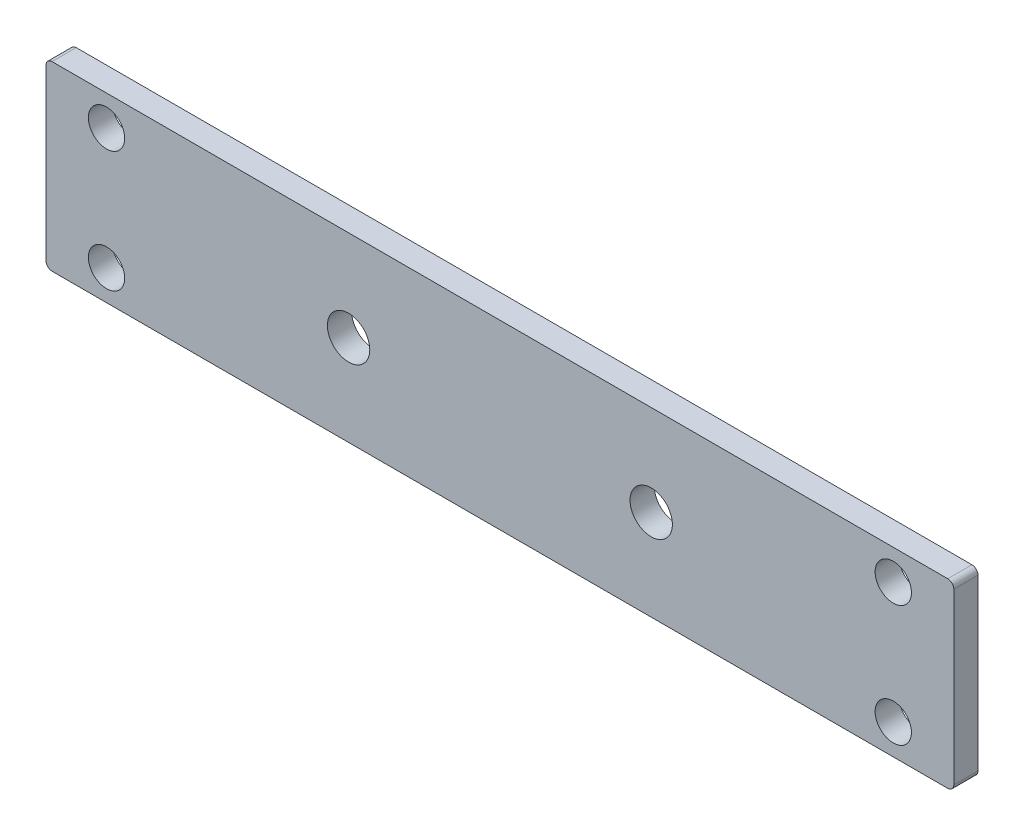
from build123d import *

# Parameters (mm, degrees)
SKETCH1_W          = 150
SKETCH1_H          = 30
SKETCH1_R          = 3.5
SKETCH1_R_2        = 3
BASE_FLANGE1_DEPTH = 4
FILLET1_R          = 1


# Sheet-metal steps are written as plain solids
with BuildPart() as part:
    # Sketch1 → Base-Flange1 (new body)
    with BuildSketch(Plane.XY):
        Rectangle(SKETCH1_W, SKETCH1_H)
        with Locations((25, 0)):
            Circle(SKETCH1_R, mode=Mode.SUBTRACT)
        with Locations((-25, 0)):
            Circle(SKETCH1_R, mode=Mode.SUBTRACT)
        with Locations((65, -10)):
            Circle(SKETCH1_R_2, mode=Mode.SUBTRACT)
        with Locations((65, 10)):
            Circle(SKETCH1_R_2, mode=Mode.SUBTRACT)
        with Locations((-65, -10)):
            Circle(SKETCH1_R_2, mode=Mode.SUBTRACT)
        with Locations((-65, 10)):
            Circle(SKETCH1_R_2, mode=Mode.SUBTRACT)
    extrude(amount=-BASE_FLANGE1_DEPTH)

    # Fillet1
    fillet1_edges = [part.edges().sort_by_distance(p)[0] for p in [
        (-75, 15, -2),
        (75, 15, -2),
        (75, -15, -2),
        (-75, -15, -2),
    ]]
    fillet(fillet1_edges, radius=FILLET1_R)


solid = part.part
